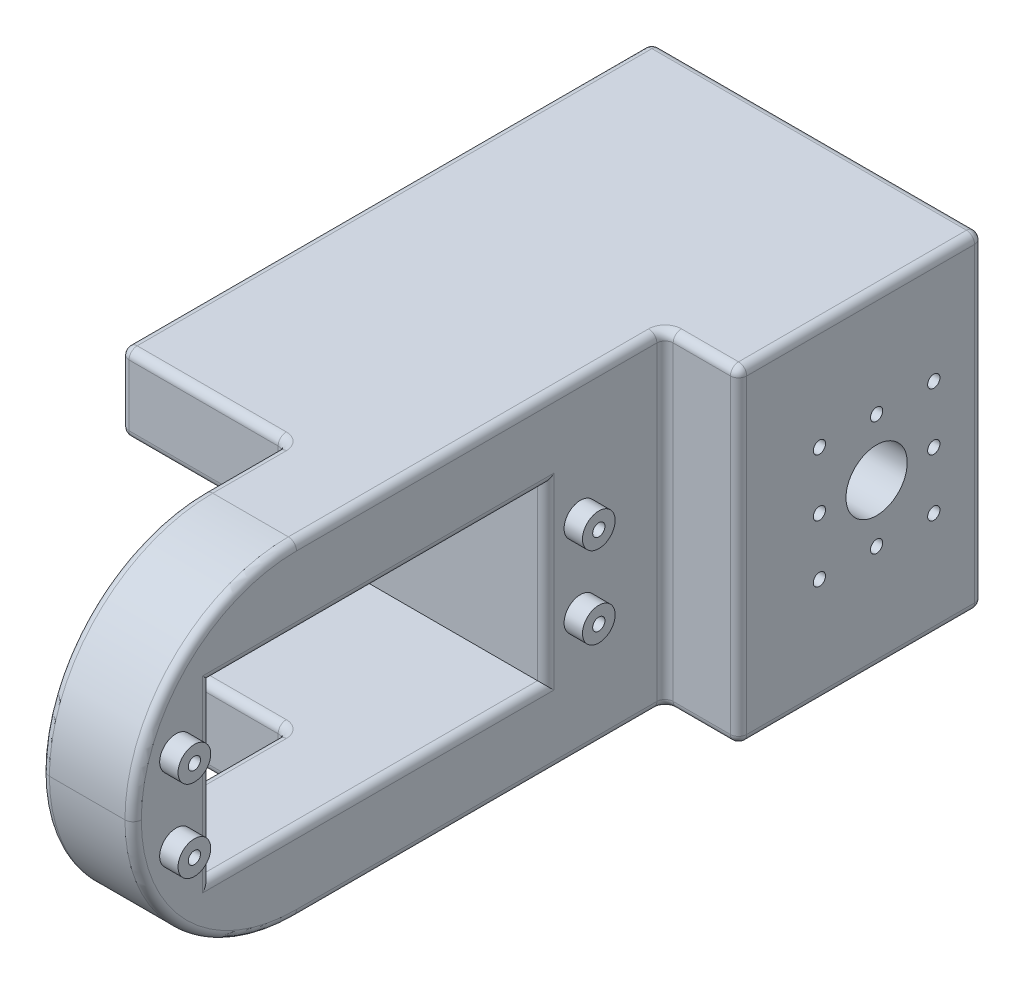
from build123d import *

# Parameters (mm, degrees)
MBODY_DEPTH             = 40
SKETCH5_R               = 0.75
FRONTSCREWS_DEPTH       = 3
SKETCH7_R               = 2.75
GUIDKNOB_DEPTH          = 4
SERVOCUT_DEPTH          = 40.5
ROUNDEDGE_R             = 20
SKETCH23_W              = 70
SKETCH23_H              = 40
TOPPUSHDOWN_DEPTH       = 9
SKETCH12_R              = 2
SERVOHOLDERS_DEPTH      = 2.25
SKETCH24_R              = 0.75
SERVOHOLDERSCREWS_DEPTH = 3.25
SKETCH14_W              = 30
SKETCH14_H              = 40
CABLEACCESS_DEPTH       = 20.25
ROUNDEDGES_R            = 1
SKETCH8_R               = 0.75
SIDESCREWS1_DEPTH       = 3
SIDESCREWS2_START       = 3
SKETCH17_R              = 0.75
SIDESCREWS2_DEPTH       = 3
SKETCH18_R              = 3.75
SIDEGUIDEHOLE_DEPTH     = 40.5


with BuildPart() as part:
    # Sketch4 → MBODY (new body)
    with BuildSketch(Plane(origin=(0, 0, 0), x_dir=(1, 0, 0), z_dir=(0, 1, 0))):
        Polygon((-5, 20), (-25.25, 20), (-25.25, -75), (-5, -75), (15.25, -75), (15.25, 20), align=None)
    extrude(amount=MBODY_DEPTH)

    # Sketch5 → FrontScrews (cut)
    with BuildSketch(Plane(origin=(0, 0, -20), x_dir=(-1, 0, 0), z_dir=(0, 0, -1))):
        with Locations((0, 5)):
            Circle(SKETCH5_R)
        with Locations((10, 5)):
            Circle(SKETCH5_R)
        with Locations((10, 15)):
            Circle(SKETCH5_R)
        with Locations((0, 15)):
            Circle(SKETCH5_R)
        with Locations((0, 25)):
            Circle(SKETCH5_R)
        with Locations((10, 25)):
            Circle(SKETCH5_R)
        with Locations((10, 35)):
            Circle(SKETCH5_R)
        with Locations((0, 35)):
            Circle(SKETCH5_R)
    extrude(amount=-FRONTSCREWS_DEPTH, mode=Mode.SUBTRACT)

    # Sketch7 → GUIDKNOB (add)
    with BuildSketch(Plane(origin=(0, 0, -20), x_dir=(-1, 0, 0), z_dir=(0, 0, -1))):
        with Locations((5, 20)):
            Circle(SKETCH7_R)
    extrude(amount=GUIDKNOB_DEPTH)

    # Sketch10 → ServoCut (cut)
    with BuildSketch(Plane(origin=(15.25, 0, 0), x_dir=(0, 0, -1), z_dir=(1, 0, 0))):
        Polygon((-65.5, 20), (-65.5, 30.5), (-24.5, 30.5), (-24.5, 9.5), (-65.5, 9.5), align=None)
    extrude(amount=-SERVOCUT_DEPTH, mode=Mode.SUBTRACT)

    # RoundEdge
    roundedge_edges = [part.edges().sort_by_distance(p)[0] for p in [
        (-5, 0, 75),
        (-5, 40, 75),
    ]]
    fillet(roundedge_edges, radius=ROUNDEDGE_R - 0.0001)  # a hair under: the kernel refuses the full size

    # Sketch23 → TOPPUSHDOWN (cut)
    with BuildSketch(Plane(origin=(15.25, 0, 0), x_dir=(0, 0, -1), z_dir=(1, 0, 0))):
        with Locations((-44.894780196, 20)):
            Rectangle(SKETCH23_W, SKETCH23_H)
    extrude(amount=-TOPPUSHDOWN_DEPTH, mode=Mode.SUBTRACT)

    # Sketch12 → SERVOHOLDERS (add)
    with BuildSketch(Plane(origin=(6.25, 0, 0), x_dir=(0, 0, -1), z_dir=(1, 0, 0))):
        with Locations(Location((-69.75, 25, 0), (0, 0, 180))):
            Circle(SKETCH12_R)
        with Locations(Location((-69.75, 15, 0), (0, 0, 180))):
            Circle(SKETCH12_R)
        with Locations(Location((-20.25, 15, 0), (0, 0, 180))):
            Circle(SKETCH12_R)
        with Locations(Location((-20.25, 25, 0), (0, 0, 180))):
            Circle(SKETCH12_R)
    extrude(amount=SERVOHOLDERS_DEPTH)

    # Sketch24 → SERVOHOLDERSCREWS (cut)
    with BuildSketch(Plane(origin=(8.5, 0, 0), x_dir=(0, 0, -1), z_dir=(1, 0, 0))):
        with Locations((-69.75, 25)):
            Circle(SKETCH24_R)
        with Locations((-69.75, 15)):
            Circle(SKETCH24_R)
        with Locations((-20.25, 25)):
            Circle(SKETCH24_R)
        with Locations((-20.25, 15)):
            Circle(SKETCH24_R)
    extrude(amount=-SERVOHOLDERSCREWS_DEPTH, mode=Mode.SUBTRACT)

    # Sketch14 → CABLEACCESS (cut)
    with BuildSketch(Plane.ZY.offset(25.25)):
        with Locations((60, 20)):
            Rectangle(SKETCH14_W, SKETCH14_H)
    extrude(amount=-CABLEACCESS_DEPTH, mode=Mode.SUBTRACT)

    # ROUNDEDGES
    roundedges_edges = [part.edges().sort_by_distance(p)[0] for p in [
        (6.25, 9.5, 45),
        (6.25, 20, 24.5),
        (15.25, 20, 9.894780196),
        (-25.25, 20, -20),
        (15.25, 20, -20),
        (-5, 5.857835087, 69.142164913),
        (-25.25, 9.5, 34.75),
        (-15.125, 9.5, 45),
        (-25.25, 30.5, 34.75),
        (-15.125, 30.5, 45),
        (-5, 4.75, 45),
        (-15.125, 0, 45),
        (-5, 40, 50.00005),
        (-15.125, 40, 45),
        (-5, 30.5, 55.25),
        (-5, 20, 65.5),
        (-5, 34.142164913, 69.142164913),
        (-5, 35.25, 45),
        (-5, 0, 50.00005),
        (-5, 9.5, 55.25),
        (-25.25, 35.25, 45),
        (15.25, 40, -5.052609902),
        (-25.25, 4.75, 45),
        (-5, 40, -20),
        (-25.25, 40, 12.5),
        (-25.25, 20, 24.5),
        (-5, 0, -20),
        (15.25, 0, -5.052609902),
        (-25.25, 0, 12.5),
        (6.25, 5.857835087, 69.142164913),
        (6.25, 40, 32.447440098),
        (6.25, 0, 32.447440098),
        (10.75, 0, 9.894780196),
        (6.25, 20, 65.5),
        (6.25, 30.5, 45),
        (6.25, 34.142164913, 69.142164913),
        (6.25, 20, 9.894780196),
        (10.75, 40, 9.894780196),
    ]]
    fillet(roundedges_edges, radius=ROUNDEDGES_R)

    # Sketch8 → SideScrews1 (cut)
    with BuildSketch(Plane(origin=(15.25, 50, 0), x_dir=(0, 0, -1), z_dir=(-1, 0, 0))):
        with Locations(Location((14, 37, 0), (0, 0, 180))):
            Circle(SKETCH8_R)
        with Locations(Location((14, 30, 0), (0, 0, 180))):
            Circle(SKETCH8_R)
        with Locations(Location((7, 37, 0), (0, 0, 180))):
            Circle(SKETCH8_R)
        with Locations(Location((14, 23, 0), (0, 0, 180))):
            Circle(SKETCH8_R)
        with Locations(Location((0, 37, 0), (0, 0, 180))):
            Circle(SKETCH8_R)
        with Locations(Location((7, 23, 0), (0, 0, 180))):
            Circle(SKETCH8_R)
        with Locations(Location((0, 30, 0), (0, 0, 180))):
            Circle(SKETCH8_R)
        with Locations(Location((0, 23, 0), (0, 0, 180))):
            Circle(SKETCH8_R)
    extrude(amount=SIDESCREWS1_DEPTH, mode=Mode.SUBTRACT)

    # Sketch17 → SideScrews2 (cut)
    with BuildSketch(Plane(origin=(-25.25, 15, 0), x_dir=(0, -1, 0), z_dir=(1, 0, 0)).offset(SIDESCREWS2_START)):
        with Locations(Location((-12, 14, 0), (0, 0, 270))):
            Circle(SKETCH17_R)
        with Locations(Location((-5, 14, 0), (0, 0, 270))):
            Circle(SKETCH17_R)
        with Locations(Location((2, 14, 0), (0, 0, 270))):
            Circle(SKETCH17_R)
        with Locations(Location((2, 7, 0), (0, 0, 270))):
            Circle(SKETCH17_R)
        with Locations(Location((-12, 7, 0), (0, 0, 270))):
            Circle(SKETCH17_R)
        with Locations(Location((-12, -0.00489205, 0), (0, 0, 90))):
            Circle(SKETCH17_R)
        with Locations(Location((-5, -0.00489205, 0), (0, 0, 90))):
            Circle(SKETCH17_R)
        with Locations(Location((2, -0.00489205, 0), (0, 0, 90))):
            Circle(SKETCH17_R)
    extrude(amount=-SIDESCREWS2_DEPTH, mode=Mode.SUBTRACT)

    # Sketch18 → SIDEGUIDEHOLE (cut)
    with BuildSketch(Plane(origin=(-25.25, 25, 0), x_dir=(0, 1, 0), z_dir=(1, 0, 0))):
        with Locations(Location((-5, -7, 0), (0, 0, 270))):
            Circle(SKETCH18_R)
    extrude(amount=SIDEGUIDEHOLE_DEPTH, mode=Mode.SUBTRACT)


solid = part.part
